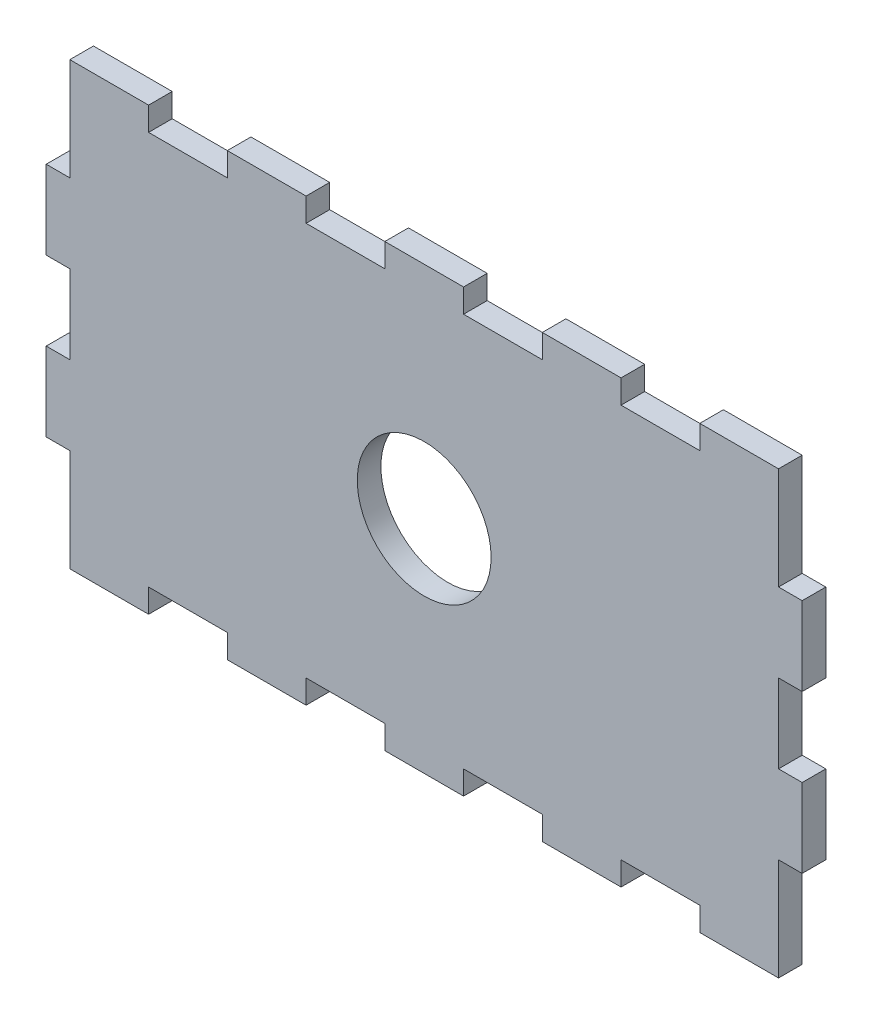
from build123d import *

# Parameters (mm, degrees)
BOSS_EXTRUDE1_DEPTH = 3
SKETCH2_R           = 8.5
CUT_EXTRUDE1_DEPTH  = 3


with BuildPart() as part:
    # Sketch1 → Boss-Extrude1 (new body)
    with BuildSketch(Plane.XY):
        Polygon((25, 28), (25, 25), (35, 25), (35, 28), (45, 28), (45, 25), (45, 15), (48, 15), (48, 5), (45, 5), (45, -5), (48, -5), (48, -15), (45, -15), (45, -25), (45, -28), (35, -28), (35, -25), (25, -25), (25, -28), (15, -28), (15, -25), (5, -25), (5, -28), (-5, -28), (-5, -25), (-15, -25), (-15, -28), (-25, -28), (-25, -25), (-35, -25), (-35, -28), (-45, -28), (-45, -25), (-45, -15), (-48, -15), (-48, -5), (-45, -5), (-45, 5), (-48, 5), (-48, 15), (-45, 15), (-45, 25), (-45, 28), (-35, 28), (-35, 25), (-25, 25), (-25, 28), (-15, 28), (-15, 25), (-5, 25), (-5, 28), (5, 28), (5, 25), (15, 25), (15, 28), align=None)
    extrude(amount=BOSS_EXTRUDE1_DEPTH)

    # Sketch2 → Cut-Extrude1 (cut)
    with BuildSketch(Plane.XY.offset(3)):
        Circle(SKETCH2_R)
    extrude(amount=-CUT_EXTRUDE1_DEPTH, mode=Mode.SUBTRACT)


solid = part.part
